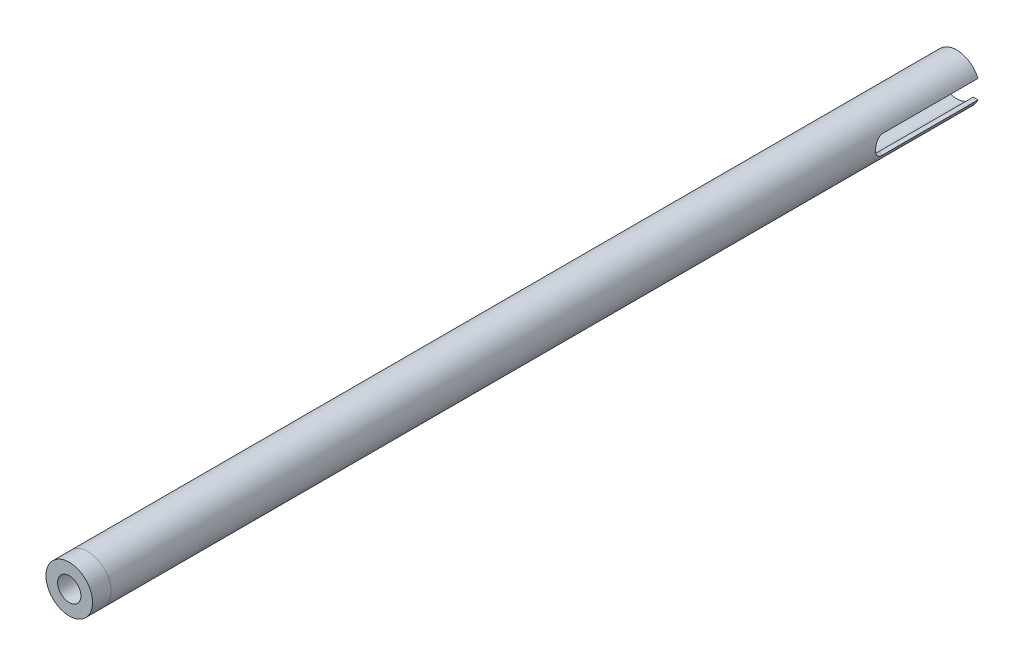
from build123d import *

# Parameters (mm, degrees)
THREADED_INSERT_1_1_DEPTH = 6.35
THREADED_START            = -6.35
THREADED_INSERT_1_2_DEPTH = 9.525
A_ARM_START               = -6.35
A_ARM_TUBE_DEPTH          = 296.019233
APEX_START                = -266.809233
APEX_SLOT_DEPTH           = 35.56
FILLET1_R                 = 3.175


with BuildPart() as part:
    # Sketch1 → Threaded insert 1-1 (new body)
    with BuildSketch(Plane.XY):
        with BuildLine():
            ThreePointArc((-2.38125, 3.175), (0, 3.96875), (2.38125, 3.175))
            Line((2.38125, 3.175), (5.630856905, 3.175))
            ThreePointArc((5.630856905, 3.175), (0, 6.4643), (-5.630856905, 3.175))
            Line((-5.630856905, 3.175), (-2.38125, 3.175))
        make_face()
        with BuildLine():
            ThreePointArc((-5.630856905, 3.175), (0, 6.4643), (5.630856905, 3.175))
            Line((5.630856905, 3.175), (7.274838916, 3.175))
            ThreePointArc((7.274838916, 3.175), (0, 7.9375), (-7.274838916, 3.175))
            Line((-7.274838916, 3.175), (-5.630856905, 3.175))
        make_face()
        with BuildLine():
            ThreePointArc((2.38125, 3.175), (3.549757914, 1.774878957), (3.96875, 0))
            Line((3.96875, 0), (6.4643, 0))
            ThreePointArc((6.4643, 0), (6.252468424, 1.641283978), (5.630856905, 3.175))
            Line((5.630856905, 3.175), (2.38125, 3.175))
        make_face()
        with BuildLine():
            Line((-6.4643, 0), (-3.96875, 0))
            ThreePointArc((-3.96875, 0), (-3.549757914, 1.774878957), (-2.38125, 3.175))
            Line((-2.38125, 3.175), (-5.630856905, 3.175))
            ThreePointArc((-5.630856905, 3.175), (-6.252468424, 1.641283978), (-6.4643, 0))
        make_face()
        with BuildLine():
            ThreePointArc((5.630856905, 3.175), (6.252468424, 1.641283978), (6.4643, 0))
            Line((6.4643, 0), (7.9375, 0))
            ThreePointArc((7.9375, 0), (7.770068859, 1.621707797), (7.274838916, 3.175))
            Line((7.274838916, 3.175), (5.630856905, 3.175))
        make_face()
        with BuildLine():
            Line((-7.9375, 0), (-6.4643, 0))
            ThreePointArc((-6.4643, 0), (-6.252468424, 1.641283978), (-5.630856905, 3.175))
            Line((-5.630856905, 3.175), (-7.274838916, 3.175))
            ThreePointArc((-7.274838916, 3.175), (-7.770068859, 1.621707797), (-7.9375, 0))
        make_face()
        with BuildLine():
            Line((7.9375, 0), (6.4643, 0))
            ThreePointArc((6.4643, 0), (6.252468424, -1.641283978), (5.630856905, -3.175))
            Line((5.630856905, -3.175), (7.274838916, -3.175))
            ThreePointArc((7.274838916, -3.175), (7.770068859, -1.621707797), (7.9375, 0))
        make_face()
        with BuildLine():
            ThreePointArc((-5.630856905, -3.175), (-6.252468424, -1.641283978), (-6.4643, 0))
            Line((-6.4643, 0), (-7.9375, 0))
            ThreePointArc((-7.9375, 0), (-7.770068859, -1.621707797), (-7.274838916, -3.175))
            Line((-7.274838916, -3.175), (-5.630856905, -3.175))
        make_face()
        with BuildLine():
            Line((6.4643, 0), (3.96875, 0))
            ThreePointArc((3.96875, 0), (3.549757914, -1.774878957), (2.38125, -3.175))
            Line((2.38125, -3.175), (5.630856905, -3.175))
            ThreePointArc((5.630856905, -3.175), (6.252468424, -1.641283978), (6.4643, 0))
        make_face()
        with BuildLine():
            ThreePointArc((-2.38125, -3.175), (-3.549757914, -1.774878957), (-3.96875, 0))
            Line((-3.96875, 0), (-6.4643, 0))
            ThreePointArc((-6.4643, 0), (-6.252468424, -1.641283978), (-5.630856905, -3.175))
            Line((-5.630856905, -3.175), (-2.38125, -3.175))
        make_face()
        with BuildLine():
            Line((5.630856905, -3.175), (2.38125, -3.175))
            ThreePointArc((2.38125, -3.175), (0, -3.96875), (-2.38125, -3.175))
            Line((-2.38125, -3.175), (-5.630856905, -3.175))
            ThreePointArc((-5.630856905, -3.175), (0, -6.4643), (5.630856905, -3.175))
        make_face()
        with BuildLine():
            Line((7.274838916, -3.175), (5.630856905, -3.175))
            ThreePointArc((5.630856905, -3.175), (0, -6.4643), (-5.630856905, -3.175))
            Line((-5.630856905, -3.175), (-7.274838916, -3.175))
            ThreePointArc((-7.274838916, -3.175), (0, -7.9375), (7.274838916, -3.175))
        make_face()
    extrude(amount=-THREADED_INSERT_1_1_DEPTH)

    # Sketch1<3> → Threaded insert 1-2 (add)
    with BuildSketch(Plane.XY.offset(THREADED_START)):
        with BuildLine():
            ThreePointArc((-2.38125, 3.175), (0, 3.96875), (2.38125, 3.175))
            Line((2.38125, 3.175), (5.630856905, 3.175))
            ThreePointArc((5.630856905, 3.175), (0, 6.4643), (-5.630856905, 3.175))
            Line((-5.630856905, 3.175), (-2.38125, 3.175))
        make_face()
        with BuildLine():
            ThreePointArc((2.38125, 3.175), (3.549757914, 1.774878957), (3.96875, 0))
            Line((3.96875, 0), (6.4643, 0))
            ThreePointArc((6.4643, 0), (6.252468424, 1.641283978), (5.630856905, 3.175))
            Line((5.630856905, 3.175), (2.38125, 3.175))
        make_face()
        with BuildLine():
            Line((-6.4643, 0), (-3.96875, 0))
            ThreePointArc((-3.96875, 0), (-3.549757914, 1.774878957), (-2.38125, 3.175))
            Line((-2.38125, 3.175), (-5.630856905, 3.175))
            ThreePointArc((-5.630856905, 3.175), (-6.252468424, 1.641283978), (-6.4643, 0))
        make_face()
        with BuildLine():
            Line((6.4643, 0), (3.96875, 0))
            ThreePointArc((3.96875, 0), (3.549757914, -1.774878957), (2.38125, -3.175))
            Line((2.38125, -3.175), (5.630856905, -3.175))
            ThreePointArc((5.630856905, -3.175), (6.252468424, -1.641283978), (6.4643, 0))
        make_face()
        with BuildLine():
            ThreePointArc((-2.38125, -3.175), (-3.549757914, -1.774878957), (-3.96875, 0))
            Line((-3.96875, 0), (-6.4643, 0))
            ThreePointArc((-6.4643, 0), (-6.252468424, -1.641283978), (-5.630856905, -3.175))
            Line((-5.630856905, -3.175), (-2.38125, -3.175))
        make_face()
        with BuildLine():
            Line((5.630856905, -3.175), (2.38125, -3.175))
            ThreePointArc((2.38125, -3.175), (0, -3.96875), (-2.38125, -3.175))
            Line((-2.38125, -3.175), (-5.630856905, -3.175))
            ThreePointArc((-5.630856905, -3.175), (0, -6.4643), (5.630856905, -3.175))
        make_face()
    extrude(amount=-THREADED_INSERT_1_2_DEPTH)


with BuildPart() as body_2:
    # Sketch1<4> → A-arm tube (new body)
    with BuildSketch(Plane.XY.offset(A_ARM_START)):
        with BuildLine():
            ThreePointArc((-5.630856905, 3.175), (0, 6.4643), (5.630856905, 3.175))
            Line((5.630856905, 3.175), (7.274838916, 3.175))
            ThreePointArc((7.274838916, 3.175), (0, 7.9375), (-7.274838916, 3.175))
            Line((-7.274838916, 3.175), (-5.630856905, 3.175))
        make_face()
        with BuildLine():
            ThreePointArc((5.630856905, 3.175), (6.252468424, 1.641283978), (6.4643, 0))
            Line((6.4643, 0), (7.9375, 0))
            ThreePointArc((7.9375, 0), (7.770068859, 1.621707797), (7.274838916, 3.175))
            Line((7.274838916, 3.175), (5.630856905, 3.175))
        make_face()
        with BuildLine():
            Line((-7.9375, 0), (-6.4643, 0))
            ThreePointArc((-6.4643, 0), (-6.252468424, 1.641283978), (-5.630856905, 3.175))
            Line((-5.630856905, 3.175), (-7.274838916, 3.175))
            ThreePointArc((-7.274838916, 3.175), (-7.770068859, 1.621707797), (-7.9375, 0))
        make_face()
        with BuildLine():
            Line((7.9375, 0), (6.4643, 0))
            ThreePointArc((6.4643, 0), (6.252468424, -1.641283978), (5.630856905, -3.175))
            Line((5.630856905, -3.175), (7.274838916, -3.175))
            ThreePointArc((7.274838916, -3.175), (7.770068859, -1.621707797), (7.9375, 0))
        make_face()
        with BuildLine():
            ThreePointArc((-5.630856905, -3.175), (-6.252468424, -1.641283978), (-6.4643, 0))
            Line((-6.4643, 0), (-7.9375, 0))
            ThreePointArc((-7.9375, 0), (-7.770068859, -1.621707797), (-7.274838916, -3.175))
            Line((-7.274838916, -3.175), (-5.630856905, -3.175))
        make_face()
        with BuildLine():
            Line((7.274838916, -3.175), (5.630856905, -3.175))
            ThreePointArc((5.630856905, -3.175), (0, -6.4643), (-5.630856905, -3.175))
            Line((-5.630856905, -3.175), (-7.274838916, -3.175))
            ThreePointArc((-7.274838916, -3.175), (0, -7.9375), (7.274838916, -3.175))
        make_face()
    extrude(amount=-A_ARM_TUBE_DEPTH)

    # Sketch1<5> → Apex slot (cut)
    with BuildSketch(Plane.XY.offset(APEX_START)):
        with BuildLine():
            ThreePointArc((5.630856905, 3.175), (6.252468424, 1.641283978), (6.4643, 0))
            Line((6.4643, 0), (7.9375, 0))
            ThreePointArc((7.9375, 0), (7.770068859, 1.621707797), (7.274838916, 3.175))
            Line((7.274838916, 3.175), (5.630856905, 3.175))
        make_face()
        with BuildLine():
            Line((-7.9375, 0), (-6.4643, 0))
            ThreePointArc((-6.4643, 0), (-6.252468424, 1.641283978), (-5.630856905, 3.175))
            Line((-5.630856905, 3.175), (-7.274838916, 3.175))
            ThreePointArc((-7.274838916, 3.175), (-7.770068859, 1.621707797), (-7.9375, 0))
        make_face()
        with BuildLine():
            Line((7.9375, 0), (6.4643, 0))
            ThreePointArc((6.4643, 0), (6.252468424, -1.641283978), (5.630856905, -3.175))
            Line((5.630856905, -3.175), (7.274838916, -3.175))
            ThreePointArc((7.274838916, -3.175), (7.770068859, -1.621707797), (7.9375, 0))
        make_face()
        with BuildLine():
            ThreePointArc((-5.630856905, -3.175), (-6.252468424, -1.641283978), (-6.4643, 0))
            Line((-6.4643, 0), (-7.9375, 0))
            ThreePointArc((-7.9375, 0), (-7.770068859, -1.621707797), (-7.274838916, -3.175))
            Line((-7.274838916, -3.175), (-5.630856905, -3.175))
        make_face()
    extrude(amount=-APEX_SLOT_DEPTH, mode=Mode.SUBTRACT)

    # Fillet1
    # the kernel refuses this fillet: 3.175 mm, written as the material it adds along each edge
    with BuildSketch(Plane(origin=(2.306643095, 3.175, -266.809233), x_dir=(0, 0, -1), z_dir=(-1, 0, 0))) as fillet1_piece_1_section:
        with BuildLine():
            CenterArc((FILLET1_R, FILLET1_R), FILLET1_R, 180, 90)
            Line((0, FILLET1_R), (0, 0))
            Line((0, 0), (FILLET1_R, 0))
        make_face()
    fillet1_piece_1 = extrude(amount=17.51898201, mode=Mode.PRIVATE)
    fillet1_piece_1 = fillet1_piece_1 - Plane(origin=(0, 0, -267.52896562), x_dir=(-0.8710698614669244, 0.49115913555994567, 0), z_dir=(0, 0, 1)) * Cylinder(6.4643, 48, mode=Mode.PRIVATE)
    fillet1_piece_1 = fillet1_piece_1 & Plane(origin=(0, 0, -267.52896562), x_dir=(-1, 0, 0), z_dir=(0, 0, 1)) * Cylinder(7.9375, 48, mode=Mode.PRIVATE)
    add(fillet1_piece_1)
    with BuildSketch(Plane(origin=(-15.212338916, -3.175, -266.809233), x_dir=(0, 0, -1), z_dir=(1, 0, 0))) as fillet1_piece_2_section:
        with BuildLine():
            CenterArc((FILLET1_R, FILLET1_R), FILLET1_R, 180, 90)
            Line((0, FILLET1_R), (0, 0))
            Line((0, 0), (FILLET1_R, 0))
        make_face()
    fillet1_piece_2 = extrude(amount=17.51898201, mode=Mode.PRIVATE)
    fillet1_piece_2 = fillet1_piece_2 - Plane(origin=(0, 0, -267.528965783), x_dir=(-0.8710698614669244, 0.49115913555994567, 0), z_dir=(0, 0, 1)) * Cylinder(6.4643, 48, mode=Mode.PRIVATE)
    fillet1_piece_2 = fillet1_piece_2 & Plane(origin=(0, 0, -267.528965783), x_dir=(-1, 0, 0), z_dir=(0, 0, 1)) * Cylinder(7.9375, 48, mode=Mode.PRIVATE)
    add(fillet1_piece_2)
    with BuildSketch(Plane(origin=(-2.306643095, -3.175, -266.809233), x_dir=(0, 0, -1), z_dir=(1, 0, 0))) as fillet1_piece_3_section:
        with BuildLine():
            CenterArc((FILLET1_R, FILLET1_R), FILLET1_R, 180, 90)
            Line((0, FILLET1_R), (0, 0))
            Line((0, 0), (FILLET1_R, 0))
        make_face()
    fillet1_piece_3 = extrude(amount=17.51898201, mode=Mode.PRIVATE)
    fillet1_piece_3 = fillet1_piece_3 - Plane(origin=(0, 0, -267.52896562), x_dir=(-0.8710698614669244, 0.49115913555994567, 0), z_dir=(0, 0, 1)) * Cylinder(6.4643, 48, mode=Mode.PRIVATE)
    fillet1_piece_3 = fillet1_piece_3 & Plane(origin=(0, 0, -267.52896562), x_dir=(-1, 0, 0), z_dir=(0, 0, 1)) * Cylinder(7.9375, 48, mode=Mode.PRIVATE)
    add(fillet1_piece_3)
    with BuildSketch(Plane(origin=(15.212338916, 3.175, -266.809233), x_dir=(0, -1, 0), z_dir=(-1, 0, 0))) as fillet1_piece_4_section:
        with BuildLine():
            CenterArc((FILLET1_R, -FILLET1_R), FILLET1_R, 90, 90)
            Line((0, -FILLET1_R), (0, 0))
            Line((0, 0), (FILLET1_R, 0))
        make_face()
    fillet1_piece_4 = extrude(amount=17.51898201, mode=Mode.PRIVATE)
    fillet1_piece_4 = fillet1_piece_4 - Plane(origin=(0, 0, -267.528965609), x_dir=(-0.8710698614669244, 0.49115913555994567, 0), z_dir=(0, 0, 1)) * Cylinder(6.4643, 48, mode=Mode.PRIVATE)
    fillet1_piece_4 = fillet1_piece_4 & Plane(origin=(0, 0, -267.528965609), x_dir=(-1, 0, 0), z_dir=(0, 0, 1)) * Cylinder(7.9375, 48, mode=Mode.PRIVATE)
    add(fillet1_piece_4)


solid = Compound([part.part, body_2.part])
